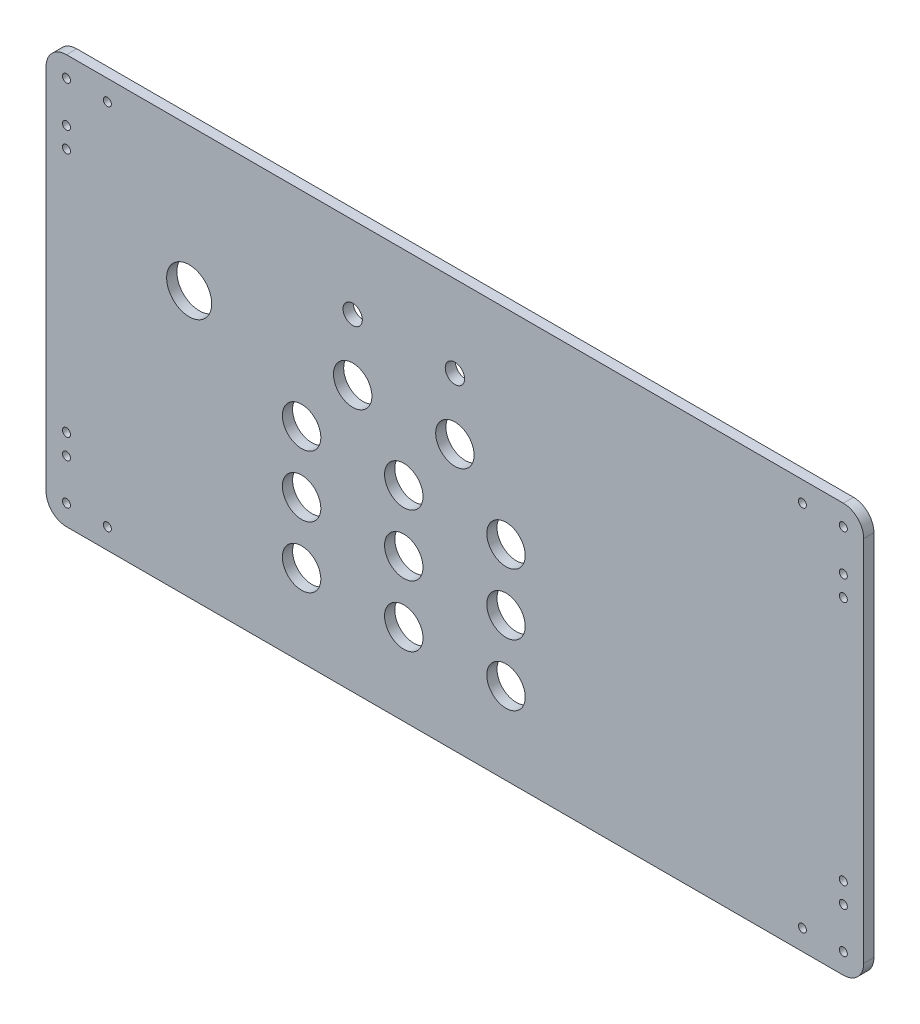
from build123d import *

# Parameters (mm, degrees)
SKETCH1_W           = 508
SKETCH1_H           = 254
BOSS_EXTRUDE1_DEPTH = 6.35
SKETCH3_R           = 11.938
SKETCH3_R_2         = 6
SKETCH3_R_3         = 14
CUT_EXTRUDE2_DEPTH  = 568.996762755
FILLET1_R           = 12.7
SKETCH4_R           = 2.4892
CUT_EXTRUDE3_DEPTH  = 568.996762755


with BuildPart() as part:
    # Sketch1 → Boss-Extrude1 (new body)
    with BuildSketch(Plane.XY):
        with Locations((254, 127)):
            Rectangle(SKETCH1_W, SKETCH1_H)
    extrude(amount=BOSS_EXTRUDE1_DEPTH)

    # Sketch3 → Cut-Extrude2 (cut, through all)
    with BuildSketch(Plane(origin=(0, 0, 0), x_dir=(-1, 0, 0), z_dir=(0, 0, -1))):
        with Locations((-158.75, 88.9)):
            Circle(SKETCH3_R)
        with Locations((-222.25, 88.9)):
            Circle(SKETCH3_R)
        with Locations((-158.75, 50.8)):
            Circle(SKETCH3_R)
        with Locations((-222.25, 50.8)):
            Circle(SKETCH3_R)
        with Locations((-222.25, 127)):
            Circle(SKETCH3_R)
        with Locations((-285.75, 127)):
            Circle(SKETCH3_R)
        with Locations((-285.75, 88.9)):
            Circle(SKETCH3_R)
        with Locations((-285.75, 50.8)):
            Circle(SKETCH3_R)
        with Locations((-254, 203.2)):
            Circle(SKETCH3_R_2)
        with Locations((-190.5, 203.2)):
            Circle(SKETCH3_R_2)
        with Locations((-158.75, 127)):
            Circle(SKETCH3_R)
        with Locations((-190.5, 165.1)):
            Circle(SKETCH3_R)
        with Locations((-254, 165.1)):
            Circle(SKETCH3_R)
        with Locations((-88.9, 165.1)):
            Circle(SKETCH3_R_3)
    extrude(amount=-CUT_EXTRUDE2_DEPTH, mode=Mode.SUBTRACT)

    # Fillet1
    fillet1_edges = [part.edges().sort_by_distance(p)[0] for p in [
        (508, 0, 3.175),
        (0, 0, 3.175),
        (0, 254, 3.175),
        (508, 254, 3.175),
    ]]
    fillet(fillet1_edges, radius=FILLET1_R)

    # Sketch4 → Cut-Extrude3 (cut, through all)
    with BuildSketch(Plane(origin=(0, 0, 0), x_dir=(-1, 0, 0), z_dir=(0, 0, -1))):
        with Locations((-495.320545376, 241.3)):
            Circle(SKETCH4_R)
        with Locations((-469.920545376, 241.3)):
            Circle(SKETCH4_R)
        with Locations((-495.320545376, 215.9)):
            Circle(SKETCH4_R)
        with Locations((-495.320545376, 203.2)):
            Circle(SKETCH4_R)
        with Locations((-469.920545376, 12.7)):
            Circle(SKETCH4_R)
        with Locations((-495.320545376, 50.8)):
            Circle(SKETCH4_R)
        with Locations((-495.320545376, 38.1)):
            Circle(SKETCH4_R)
        with Locations((-495.320545376, 12.7)):
            Circle(SKETCH4_R)
        with Locations((-12.679454624, 50.8)):
            Circle(SKETCH4_R)
        with Locations((-12.679454624, 38.1)):
            Circle(SKETCH4_R)
        with Locations((-12.679454624, 12.7)):
            Circle(SKETCH4_R)
        with Locations((-38.079454624, 12.7)):
            Circle(SKETCH4_R)
        with Locations((-12.679454624, 203.2)):
            Circle(SKETCH4_R)
        with Locations((-12.679454624, 215.9)):
            Circle(SKETCH4_R)
        with Locations((-12.679454624, 241.3)):
            Circle(SKETCH4_R)
        with Locations((-38.079454624, 241.3)):
            Circle(SKETCH4_R)
    extrude(amount=-CUT_EXTRUDE3_DEPTH, mode=Mode.SUBTRACT)


solid = part.part
